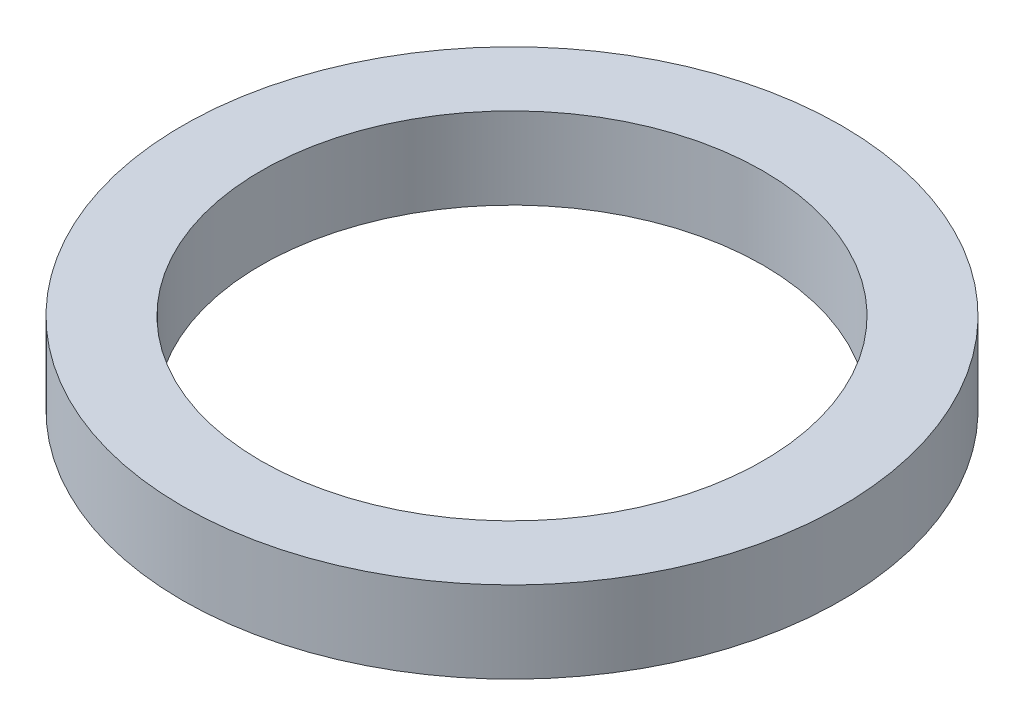
from build123d import *

# Parameters (mm, degrees)
SKETCH1_R           = 52.5
BOSS_EXTRUDE1_DEPTH = 13
SKETCH2_R           = 40
CUT_EXTRUDE1_DEPTH  = 76.375725535


with BuildPart() as part:
    # Sketch1 → Boss-Extrude1 (new body)
    with BuildSketch(Plane(origin=(0, 0, 0), x_dir=(1, 0, 0), z_dir=(0, 1, 0))):
        Circle(SKETCH1_R)
    extrude(amount=BOSS_EXTRUDE1_DEPTH)

    # Sketch2 → Cut-Extrude1 (cut, through all)
    with BuildSketch(Plane(origin=(0, 0, 0), x_dir=(1, 0, 0), z_dir=(0, 1, 0))):
        Circle(SKETCH2_R)
    extrude(amount=CUT_EXTRUDE1_DEPTH, mode=Mode.SUBTRACT)


solid = part.part
